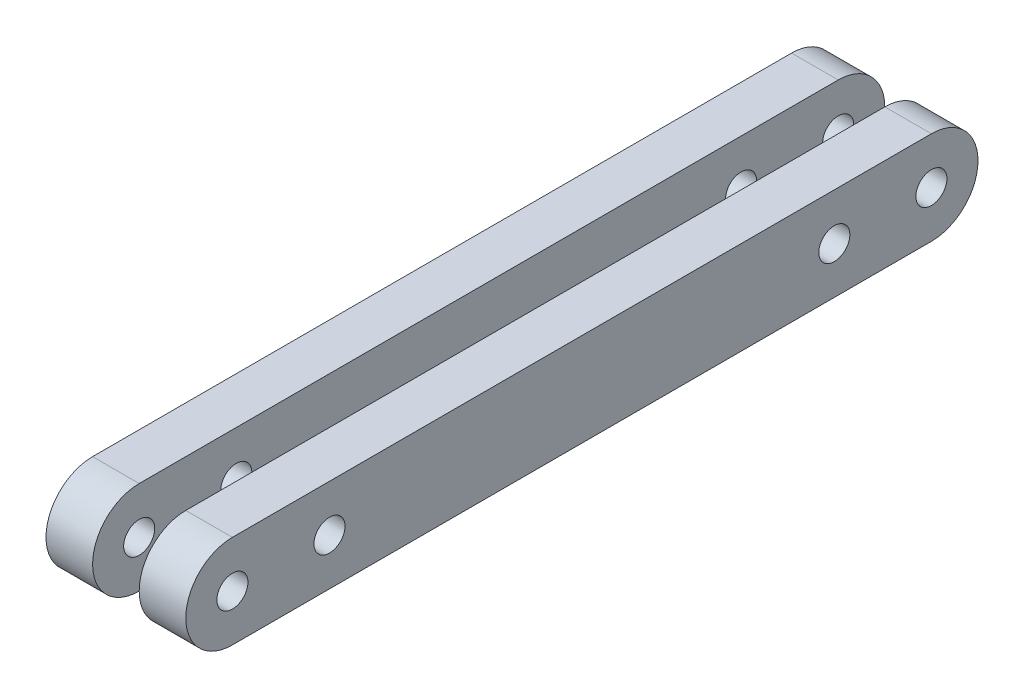
from build123d import *

# Parameters (mm, degrees)
BOSS_EXTRUDE1_DEPTH            = 6
CUT_EXTRUDE1_DEPTH             = 97.374270425
CUT_EXTRUDE1_DEPTH_BACK        = 97.374270425
SKETCH2_R                      = 2
SKETCH6_W                      = 2
SKETCH6_H                      = 18
F_4_0MM_DOWEL_HOLE1_AT_2_COUNT = 2
F_4_0MM_DOWEL_HOLE1_AT_2_PITCH = 65


with BuildPart() as part:
    # Sketch1 → Boss-Extrude1 (new body)
    with BuildSketch(Plane(origin=(3, 0, 0), x_dir=(0, 0, -1), z_dir=(1, 0, 0))):
        with BuildLine():
            Line((0, 6), (90, 6))
            ThreePointArc((90, 6), (96, 0), (90, -6))
            Line((90, -6), (0, -6))
            ThreePointArc((0, -6), (-6, 0), (0, 6))
        make_face()
    extrude(amount=BOSS_EXTRUDE1_DEPTH)

    # Sketch2 → Cut-Extrude1 (cut, two sides: drawn at the far end of the back side and taken through both)
    with BuildSketch(Plane(origin=(9, 0, 0), x_dir=(0, 0, -1), z_dir=(1, 0, 0)).offset(-CUT_EXTRUDE1_DEPTH_BACK)):
        Circle(SKETCH2_R)
        with Locations((90, 0)):
            Circle(SKETCH2_R)
    extrude(amount=CUT_EXTRUDE1_DEPTH + CUT_EXTRUDE1_DEPTH_BACK, mode=Mode.SUBTRACT)


with BuildPart() as body_2:
    # Mirror4: mirrored copy
    add(part.part.mirror(Plane(origin=(0, 0, 0), x_dir=(0, 0, 1), z_dir=(1, 0, 0))))


with BuildPart() as f_4_0mm_dowel_hole1_tool:
    # Sketch6 → Ø4.0mm Dowel Hole1 (revolve)
    with BuildSketch(Plane(origin=(9, 0, -77.5), x_dir=(0, 0, -1), z_dir=(0, 1, 0))):
        with Locations((1, 9)):
            Rectangle(SKETCH6_W, SKETCH6_H)
    f_4_0mm_dowel_hole1 = revolve(axis=Axis((15.35, 0, -77.5), (-1, 0, 0)))


with BuildPart() as part_1:
    add(part.part)

    # Ø4.0mm Dowel Hole1: cut by f_4_0mm_dowel_hole1_tool
    add(f_4_0mm_dowel_hole1_tool.part, mode=Mode.SUBTRACT)


with BuildPart() as body_2_1:
    add(body_2.part)

    # Ø4.0mm Dowel Hole1: cut by f_4_0mm_dowel_hole1_tool
    add(f_4_0mm_dowel_hole1_tool.part, mode=Mode.SUBTRACT)


with BuildPart() as f_4_0mm_dowel_hole1_at_2_tool:
    # Ø4.0mm Dowel Hole1 at 2: Ø4.0mm Dowel Hole1 ×2
    with Locations(*[(0, 0, i * F_4_0MM_DOWEL_HOLE1_AT_2_PITCH) for i in range(1, F_4_0MM_DOWEL_HOLE1_AT_2_COUNT)]):
        add(f_4_0mm_dowel_hole1)


with BuildPart() as part_2:
    add(part_1.part)

    # Ø4.0mm Dowel Hole1 at 2: cut by f_4_0mm_dowel_hole1_at_2_tool
    add(f_4_0mm_dowel_hole1_at_2_tool.part, mode=Mode.SUBTRACT)


with BuildPart() as body_2_2:
    add(body_2_1.part)

    # Ø4.0mm Dowel Hole1 at 2: cut by f_4_0mm_dowel_hole1_at_2_tool
    add(f_4_0mm_dowel_hole1_at_2_tool.part, mode=Mode.SUBTRACT)


solid = Compound([part_2.part, body_2_2.part])
